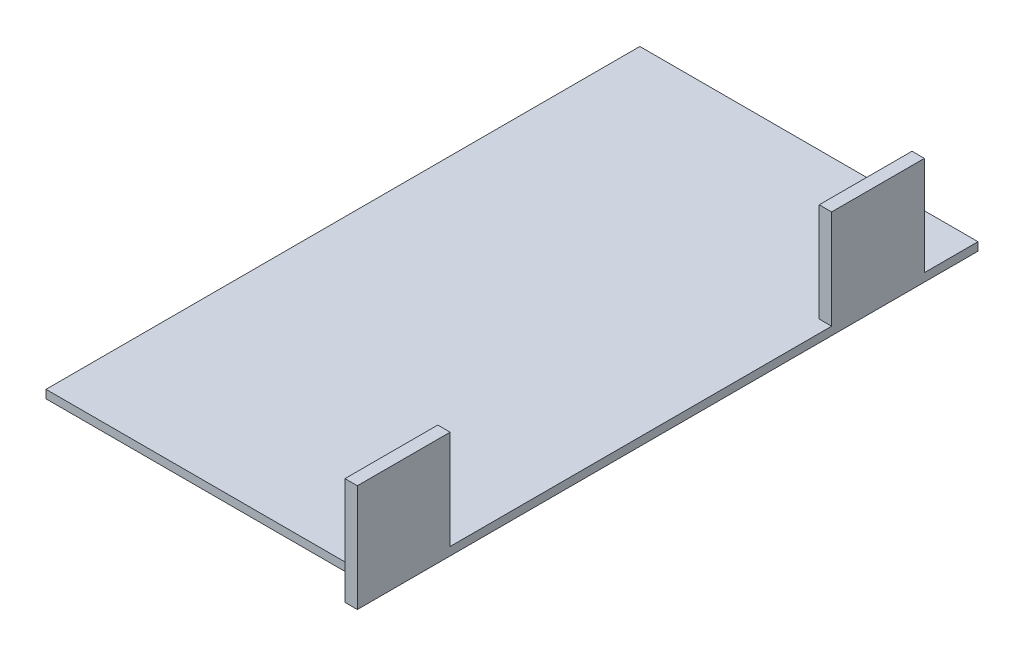
from build123d import *

# Parameters (mm, degrees)
CROQUIS1_W              = 82
CROQUIS1_H              = 144
SALIENTE_EXTRUIR1_DEPTH = 2
CROQUIS2_W              = 3
CROQUIS2_H              = 22.5
SALIENTE_EXTRUIR4_DEPTH = 26


with BuildPart() as part:
    # Croquis1 → Saliente-Extruir1 (new body)
    with BuildSketch(Plane(origin=(0, 0, 0), x_dir=(1, 0, 0), z_dir=(0, 1, 0))):
        Rectangle(CROQUIS1_W, CROQUIS1_H)
    extrude(amount=SALIENTE_EXTRUIR1_DEPTH)

    # Croquis2 → Saliente-Extruir4 (add)
    with BuildSketch(Plane.XZ):
        with Locations((39.5, 67.25)):
            Rectangle(CROQUIS2_W, CROQUIS2_H)
        with Locations((39.5, -47.75)):
            Rectangle(CROQUIS2_W, CROQUIS2_H)
    extrude(amount=-SALIENTE_EXTRUIR4_DEPTH)


solid = part.part
